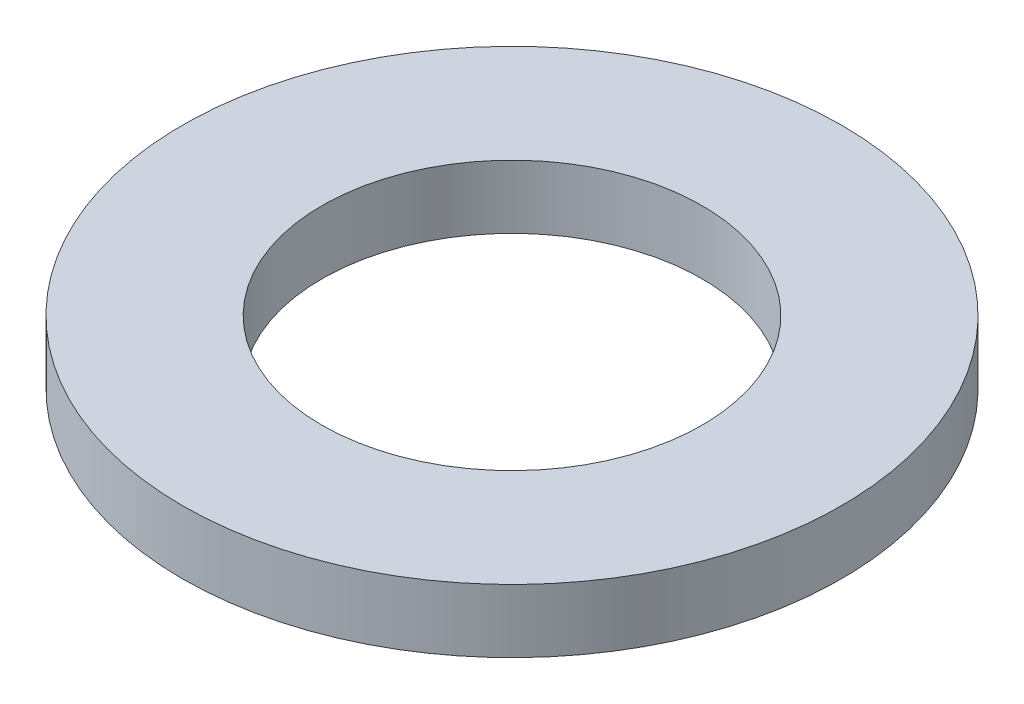
from build123d import *

# Parameters (mm, degrees)
SKETCH1_R           = 66.04
SKETCH1_R_2         = 38.1
BOSS_EXTRUDE1_DEPTH = 12.7


with BuildPart() as part:
    # Sketch1 → Boss-Extrude1 (new body)
    with BuildSketch(Plane(origin=(0, 0, 0), x_dir=(1, 0, 0), z_dir=(0, 1, 0))):
        Circle(SKETCH1_R)
        Circle(SKETCH1_R_2, mode=Mode.SUBTRACT)
    extrude(amount=BOSS_EXTRUDE1_DEPTH)


solid = part.part
